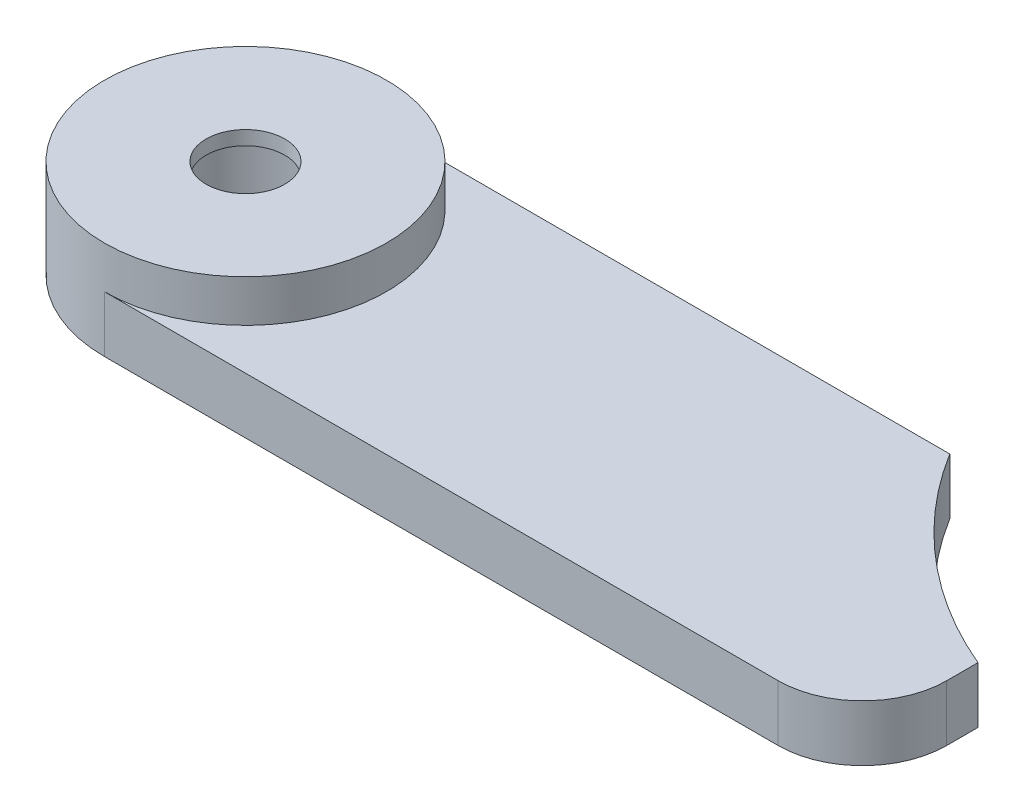
from build123d import *

# Parameters (mm, degrees)
SKETCH1_R           = 5.025
SKETCH1_R_2         = 2.025
BOSS_EXTRUDE1_DEPTH = 3
SKETCH2_W           = 27
SKETCH2_H           = 10.05
BOSS_EXTRUDE2_DEPTH = 2
SKETCH3_R           = 15
CUT_EXTRUDE1_DEPTH  = 2
FILLET1_R           = 3
SKETCH4_R           = 2.75
CUT_EXTRUDE2_DEPTH  = 10
SKETCH5_R           = 5.025
BOSS_EXTRUDE3_DEPTH = 0.5
SKETCH6_R           = 1.4
CUT_EXTRUDE3_DEPTH  = 0.5


with BuildPart() as part:
    # Sketch1 → Boss-Extrude1 (new body)
    with BuildSketch(Plane(origin=(0, 0, 0), x_dir=(1, 0, 0), z_dir=(0, 1, 0))):
        Circle(SKETCH1_R)
        Circle(SKETCH1_R_2, mode=Mode.SUBTRACT)
    extrude(amount=BOSS_EXTRUDE1_DEPTH)

    # Sketch2 → Boss-Extrude2 (add)
    with BuildSketch(Plane.XZ):
        with Locations((13.5, 0)):
            Rectangle(SKETCH2_W, SKETCH2_H)
    extrude(amount=-BOSS_EXTRUDE2_DEPTH)

    # Sketch3 → Cut-Extrude1 (cut)
    with BuildSketch(Plane(origin=(0, 2, 0), x_dir=(1, 0, 0), z_dir=(0, 1, 0))):
        with Locations((32.816228029, 12.917418084)):
            Circle(SKETCH3_R)
    extrude(amount=-CUT_EXTRUDE1_DEPTH, mode=Mode.SUBTRACT)

    # Fillet1
    fillet1_edges = [part.edges().sort_by_distance(p)[0] for p in [
        (27, 1, 5.025),
    ]]
    fillet(fillet1_edges, radius=FILLET1_R)

    # Sketch4 → Cut-Extrude2 (cut)
    with BuildSketch(Plane(origin=(0, 3, 0), x_dir=(1, 0, 0), z_dir=(0, 1, 0))):
        Circle(SKETCH4_R)
    extrude(amount=-CUT_EXTRUDE2_DEPTH, mode=Mode.SUBTRACT)

    # Sketch5 → Boss-Extrude3 (add)
    with BuildSketch(Plane(origin=(0, 3, 0), x_dir=(1, 0, 0), z_dir=(0, 1, 0))):
        Circle(SKETCH5_R)
    extrude(amount=BOSS_EXTRUDE3_DEPTH)

    # Sketch6 → Cut-Extrude3 (cut)
    with BuildSketch(Plane.XZ.offset(-3)):
        Circle(SKETCH6_R)
    extrude(amount=-CUT_EXTRUDE3_DEPTH, mode=Mode.SUBTRACT)


solid = part.part
